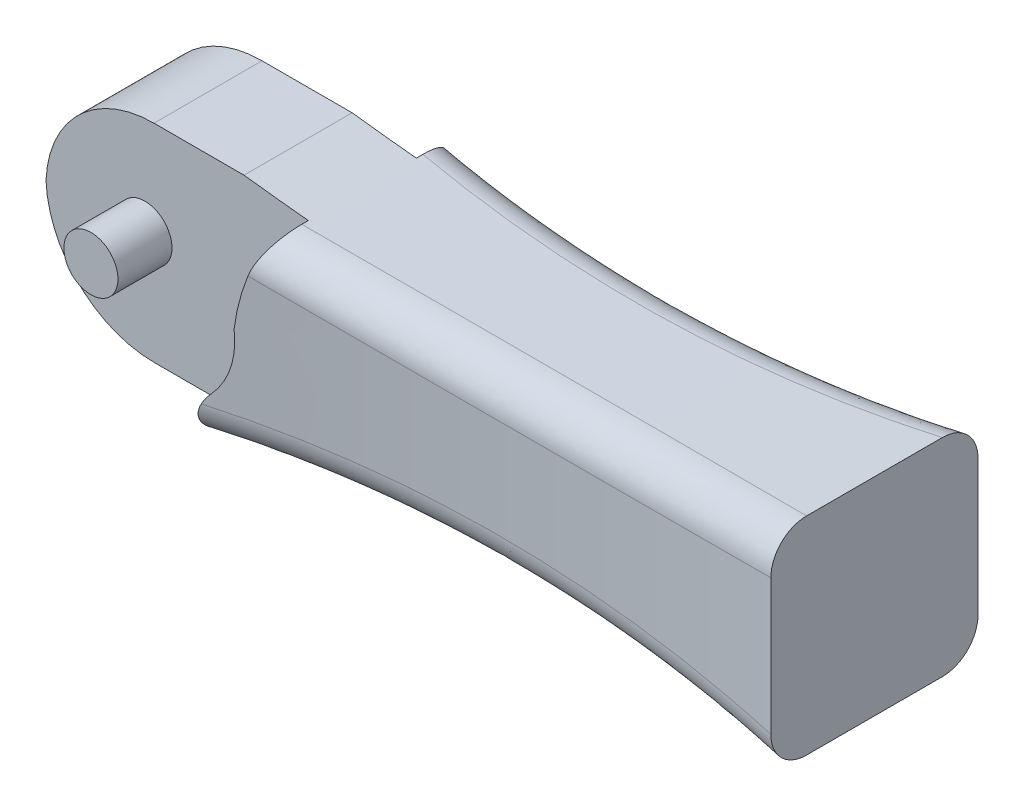
from build123d import *

# Parameters (mm, degrees)
SKETCH1_W                = 6
SKETCH1_H                = 11.5
BOSS_EXTRUDE1_DEPTH      = 11
BOSS_EXTRUDE2_DEPTH      = 3
BOSS_EXTRUDE2_DEPTH_BACK = 9
SKETCH2_R                = 1.5
FILLET2_R                = 2
CUT_EXTRUDE4_DEPTH       = 3
FILLET8_R                = 3
CUT_EXTRUDE7_DEPTH       = 45.306461264
FILLET9_R                = 6


with BuildPart() as part:
    # Sketch1 → Boss-Extrude1 (new body)
    with BuildSketch(Plane(origin=(0, 0, 0), x_dir=(0, 0, -1), z_dir=(1, 0, 0))):
        Rectangle(SKETCH1_W, SKETCH1_H)
    extrude(amount=BOSS_EXTRUDE1_DEPTH)

    # Sketch2 → Boss-Extrude2 (add, two sides: drawn at the far end of the back side and taken through both)
    with BuildSketch(Plane.XY.offset(3).offset(-BOSS_EXTRUDE2_DEPTH_BACK)):
        with Locations((5.5, 0.25)):
            Circle(SKETCH2_R)
    extrude(amount=BOSS_EXTRUDE2_DEPTH + BOSS_EXTRUDE2_DEPTH_BACK)

    # Sketch3 → Loft1 section 0
    with BuildSketch(Plane(origin=(11, 0, 0), x_dir=(0, 0, -1), z_dir=(1, 0, 0))):
        with BuildLine():
            Line((5.75, -5.75), (-5.75, -5.75))
            Line((-5.75, -5.75), (-5.75, 5.75))
            Line((-5.75, 5.75), (5.75, 5.75))
            Line((5.75, 5.75), (5.75, -5.75))
        make_face()
    # Sketch4 → Loft1 section 1
    with BuildSketch(Plane(origin=(27, 0, 0), x_dir=(0, 0, -1), z_dir=(1, 0, 0))):
        with BuildLine():
            Line((4.75, -4.75), (-4.75, -4.75))
            Line((-4.75, -4.75), (-4.75, 4.75))
            Line((-4.75, 4.75), (4.75, 4.75))
            Line((4.75, 4.75), (4.75, -4.75))
        make_face()
    # Sketch5 → Loft1 section 2
    with BuildSketch(Plane(origin=(43, 0, 0), x_dir=(0, 0, -1), z_dir=(1, 0, 0))):
        with BuildLine():
            Line((5.75, -5.75), (-5.75, -5.75))
            Line((-5.75, -5.75), (-5.75, 5.75))
            Line((-5.75, 5.75), (5.75, 5.75))
            Line((5.75, 5.75), (5.75, -5.75))
        make_face()
    loft()

    # Fillet2
    fillet2_edges = [part.edges().sort_by_distance(p)[0] for p in [
        (27, 4.75, -4.75),
        (27, -4.75, -4.75),
        (27, -4.75, 4.75),
        (27, 4.75, 4.75),
    ]]
    fillet(fillet2_edges, radius=FILLET2_R)

    # Sketch11 → Cut-Extrude4 (cut)
    with BuildSketch(Plane(origin=(0, 0, -3), x_dir=(-1, 0, 0), z_dir=(0, 0, -1))):
        with BuildLine():
            Line((-8.5, 4.5), (-8.5, -4.5))
            ThreePointArc((-8.5, -4.5), (-13, 0), (-8.5, 4.5))
        make_face()
    cut_extrude4 = extrude(amount=CUT_EXTRUDE4_DEPTH, mode=Mode.SUBTRACT)

    # Mirror2: Cut-Extrude4 across plane
    add(cut_extrude4.mirror(Plane.XY), mode=Mode.SUBTRACT)

    # Fillet8
    fillet8_edges = [part.edges().sort_by_distance(p)[0] for p in [
        (11, 3.741657387, 4.375),
        (11, -3.741657387, 4.375),
        (11, 3.741657387, -4.375),
        (11, -3.741657387, -4.375),
    ]]
    fillet(fillet8_edges, radius=FILLET8_R)

    # Sketch14 → Cut-Extrude7 (cut, through all)
    with BuildSketch(Plane(origin=(0, 0, -3), x_dir=(-1, 0, 0), z_dir=(0, 0, -1))):
        with BuildLine():
            Line((-8.853025193, 6.183254842), (-15.095603268, 6.183254842))
            add(Edge.make_bspline(
                [(-12.96305568, 0.575442436), (-13.32215255, 3.608062735), (-15.095603268, 6.183254842)],
                knots=[0, 0, 0, 1, 1, 1], degree=2))
            Line((-12.96305568, 0.575442436), (-8.853025193, 6.183254842))
        make_face()
    cut_extrude7 = extrude(amount=CUT_EXTRUDE7_DEPTH, mode=Mode.SUBTRACT)

    # Mirror3: Cut-Extrude7 across plane
    add(cut_extrude7.mirror(Plane.XY), mode=Mode.SUBTRACT)

    # Fillet9
    # the kernel refuses this fillet: 6 mm, written as the material it takes off along each edge
    with BuildSketch(Plane(origin=(0, 5.75, 18), x_dir=(0, -1, 0), z_dir=(0, 0, -1))) as fillet9_piece_1:
        with BuildLine():
            CenterArc((FILLET9_R, -FILLET9_R), FILLET9_R, 90, 90)
            Line((0, -FILLET9_R), (0, 0))
            Line((0, 0), (FILLET9_R, 0))
        make_face()
    extrude(amount=36, mode=Mode.SUBTRACT)
    with BuildSketch(Plane(origin=(0, -5.75, -18), x_dir=(1, 0, 0), z_dir=(0, 0, 1))) as fillet9_piece_2:
        with BuildLine():
            CenterArc((FILLET9_R, FILLET9_R), FILLET9_R, 180, 90)
            Line((0, FILLET9_R), (0, 0))
            Line((0, 0), (FILLET9_R, 0))
        make_face()
    extrude(amount=36, mode=Mode.SUBTRACT)


solid = part.part
